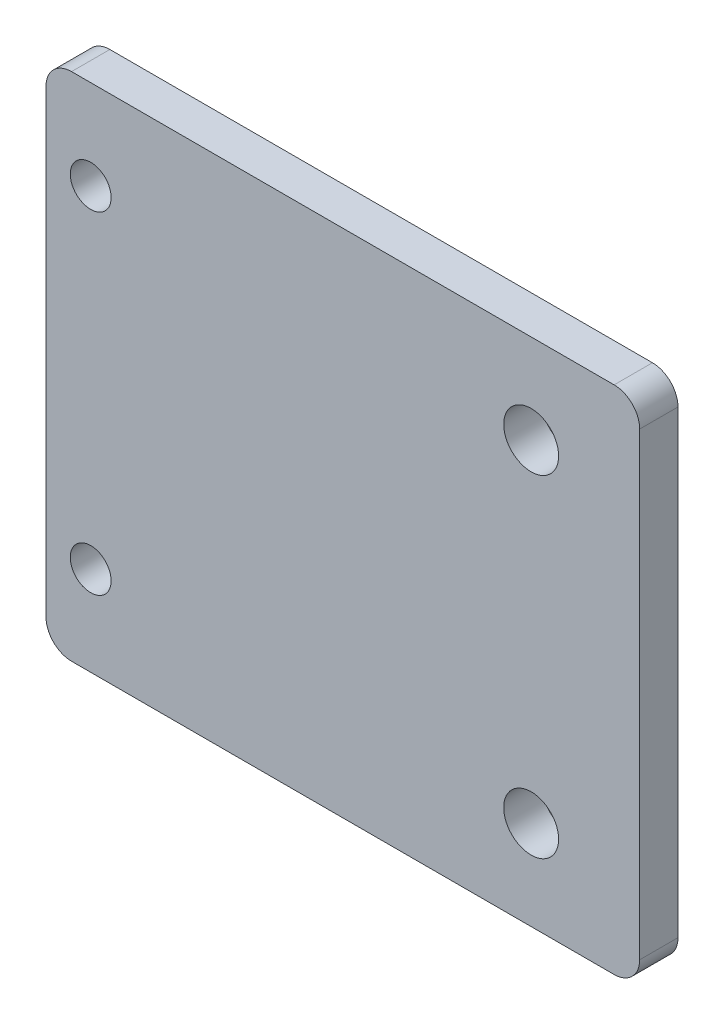
from build123d import *

# Parameters (mm, degrees)
SKETCH1_W                = 46.5
SKETCH1_H                = 40
BOSS_EXTRUDE1_DEPTH      = 3
M3_CLEARANCE_HOLE1_D     = 3.2
M3_CLEARANCE_HOLE1_DEPTH = 8
M3_CLEARANCE_HOLE1_TIP   = 0.96137699
M4_CLEARANCE_HOLE1_D     = 4.3
M4_CLEARANCE_HOLE1_DEPTH = 8
M4_CLEARANCE_HOLE1_TIP   = 1.291850331
FILLET1_R                = 2


with BuildPart() as part:
    # Sketch1 → Boss-Extrude1 (new body)
    with BuildSketch(Plane.XY):
        Rectangle(SKETCH1_W, SKETCH1_H)
    extrude(amount=BOSS_EXTRUDE1_DEPTH)

    # M3 Clearance Hole1
    with Locations(Plane.XY.offset(3)):
        with Locations((-19.75, 13), (-19.75, -13)):
            Hole(M3_CLEARANCE_HOLE1_D / 2, depth=M3_CLEARANCE_HOLE1_DEPTH)
            with Locations((0, 0, -(M3_CLEARANCE_HOLE1_DEPTH + M3_CLEARANCE_HOLE1_TIP / 2))):  # 118° drill point
                Cone(0, M3_CLEARANCE_HOLE1_D / 2, M3_CLEARANCE_HOLE1_TIP, mode=Mode.SUBTRACT)

    # M4 Clearance Hole1
    with Locations(Plane.XY.offset(3)):
        with Locations((14.75, 13), (14.75, -13)):
            Hole(M4_CLEARANCE_HOLE1_D / 2, depth=M4_CLEARANCE_HOLE1_DEPTH)
            with Locations((0, 0, -(M4_CLEARANCE_HOLE1_DEPTH + M4_CLEARANCE_HOLE1_TIP / 2))):  # 118° drill point
                Cone(0, M4_CLEARANCE_HOLE1_D / 2, M4_CLEARANCE_HOLE1_TIP, mode=Mode.SUBTRACT)

    # Fillet1
    fillet1_edges = [part.edges().sort_by_distance(p)[0] for p in [
        (23.25, 20, 1.5),
        (23.25, -20, 1.5),
        (-23.25, -20, 1.5),
        (-23.25, 20, 1.5),
    ]]
    fillet(fillet1_edges, radius=FILLET1_R)


solid = part.part
